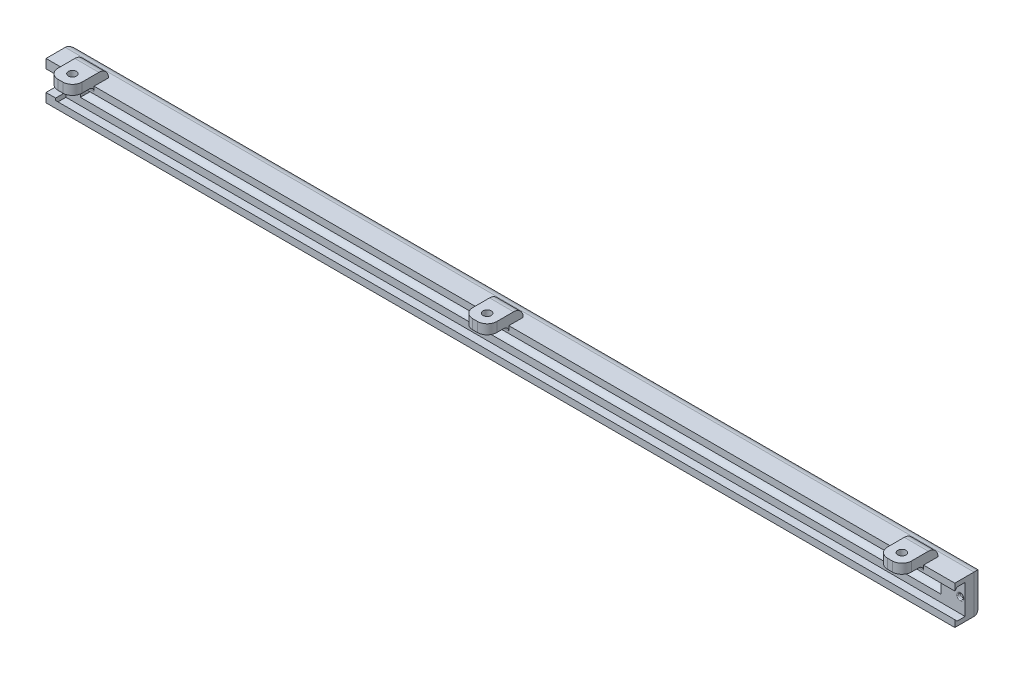
from build123d import *

# Parameters (mm, degrees)
SKETCH1_W               = 378
SKETCH1_H               = 16
BOSS_EXTRUDE1_DEPTH     = 6
CUT_EXTRUDE1_DEPTH      = 381.976768496
CUT_EXTRUDE1_DEPTH_BACK = 374
SKETCH3_W               = 4.3
SKETCH3_H               = 12.3
BOSS_EXTRUDE2_DEPTH     = 374
BOSS_EXTRUDE3_DEPTH     = 374
SKETCH6_W               = 4
SKETCH6_H               = 8.5
CUT_EXTRUDE2_DEPTH      = 378.00835287
SKETCH13_W              = 10
SKETCH13_H              = 15
BOSS_EXTRUDE5_DEPTH     = 4
FILLET10_R              = 4
SKETCH14_R              = 1.7
CUT_EXTRUDE5_DEPTH      = 4
FILLET11_R              = 4
FILLET12_R              = 4
LPATTERN3_COUNT         = 3
LPATTERN3_PITCH         = 172.5
LPATTERN4_COUNT         = 3
LPATTERN4_PITCH         = 172.5
FILLET13_R              = 4
FILLET14_R              = 4
FILLET16_R              = 4
FILLET17_R              = 4
FILLET18_R              = 4
FILLET19_R              = 4
FILLET20_R              = 2
FILLET21_R              = 2
FILLET22_R              = 2
SKETCH17_W              = 378
SKETCH17_H              = 16
BOSS_EXTRUDE6_DEPTH     = 6
FILLET25_R              = 4
SKETCH18_R              = 1
CUT_EXTRUDE6_DEPTH      = 0.7
FILLET26_R              = 0.5
FILLET27_R              = 0.5
SKETCH19_W              = 358
SKETCH19_H              = 6.3
CUT_EXTRUDE7_DEPTH      = 3
FILLET28_R              = 3


with BuildPart() as part:
    # Sketch1 → Boss-Extrude1 (new body)
    with BuildSketch(Plane.XY):
        with Locations((31.46991404, 39.151862464)):
            Rectangle(SKETCH1_W, SKETCH1_H)
    extrude(amount=BOSS_EXTRUDE1_DEPTH)

    # Sketch3 → Cut-Extrude1 (cut, two sides: drawn at the far end of the back side and taken through both)
    with BuildSketch(Plane(origin=(220.46991404, 0, 0), x_dir=(0, 0, -1), z_dir=(1, 0, 0)).offset(-CUT_EXTRUDE1_DEPTH_BACK)):
        with Locations((-3.85, 39.151862464)):
            Rectangle(SKETCH3_W, SKETCH3_H)
    extrude(amount=CUT_EXTRUDE1_DEPTH + CUT_EXTRUDE1_DEPTH_BACK, mode=Mode.SUBTRACT)

    # Sketch4 → Boss-Extrude2 (add)
    with BuildSketch(Plane(origin=(220.46991404, 0, 0), x_dir=(0, 0, -1), z_dir=(1, 0, 0))):
        Polygon((-6, 33.001862464), (-6, 34.001862464), (-5, 33.001862464), align=None)
    extrude(amount=-BOSS_EXTRUDE2_DEPTH)

    # Sketch5 → Boss-Extrude3 (add)
    with BuildSketch(Plane(origin=(220.46991404, 0, 0), x_dir=(0, 0, -1), z_dir=(1, 0, 0))):
        Polygon((-6, 45.301862464), (-6, 44.301862464), (-5, 45.301862464), align=None)
    extrude(amount=-BOSS_EXTRUDE3_DEPTH)

    # Sketch6 → Cut-Extrude2 (cut, through all)
    with BuildSketch(Plane(origin=(-153.53008596, 0, 0), x_dir=(0, 0, -1), z_dir=(1, 0, 0))):
        with Locations((-4, 39.151862464)):
            Rectangle(SKETCH6_W, SKETCH6_H)
    extrude(amount=-CUT_EXTRUDE2_DEPTH, mode=Mode.SUBTRACT)

    # Sketch13 → Boss-Extrude5 (add)
    with BuildSketch(Plane(origin=(0, 47.151862464, 0), x_dir=(1, 0, 0), z_dir=(0, 1, 0))):
        with Locations((-142.53008596, -7.5)):
            Rectangle(SKETCH13_W, SKETCH13_H)
    boss_extrude5 = extrude(amount=BOSS_EXTRUDE5_DEPTH)

    # Fillet10
    fillet10_edges = [part.edges().sort_by_distance(p)[0] for p in [
        (-142.53008596, 51.151862464, 0),
    ]]
    fillet(fillet10_edges, radius=FILLET10_R)

    # Sketch14 → Cut-Extrude5 (cut)
    with BuildSketch(Plane.XZ.offset(-47.151862464)):
        with Locations(Location((-142.53008596, 10, 0), (0, 0, 270))):
            Circle(SKETCH14_R)
    cut_extrude5 = extrude(amount=-CUT_EXTRUDE5_DEPTH, mode=Mode.SUBTRACT)

    # Fillet11
    fillet11_edges = [part.edges().sort_by_distance(p)[0] for p in [
        (-137.53008596, 49.151862464, 15),
    ]]
    fillet(fillet11_edges, radius=FILLET11_R)

    # Fillet12
    fillet12_edges = [part.edges().sort_by_distance(p)[0] for p in [
        (-147.53008596, 49.151862464, 15),
    ]]
    fillet(fillet12_edges, radius=FILLET12_R)

    # LPattern3: Boss-Extrude5 ×3
    with Locations(*[(i * LPATTERN3_PITCH, 0, 0) for i in range(1, LPATTERN3_COUNT)]):
        add(boss_extrude5)

    # LPattern4: Cut-Extrude5 ×3
    with Locations(*[(i * LPATTERN4_PITCH, 0, 0) for i in range(1, LPATTERN4_COUNT)]):
        add(cut_extrude5, mode=Mode.SUBTRACT)

    # Fillet13
    fillet13_edges = [part.edges().sort_by_distance(p)[0] for p in [
        (29.96991404, 51.151862464, 0),
    ]]
    fillet(fillet13_edges, radius=FILLET13_R)

    # Fillet14
    fillet14_edges = [part.edges().sort_by_distance(p)[0] for p in [
        (202.46991404, 51.151862464, 0),
    ]]
    fillet(fillet14_edges, radius=FILLET14_R)

    # Fillet16
    fillet16_edges = [part.edges().sort_by_distance(p)[0] for p in [
        (24.96991404, 49.151862464, 15),
    ]]
    fillet(fillet16_edges, radius=FILLET16_R)

    # Fillet17
    fillet17_edges = [part.edges().sort_by_distance(p)[0] for p in [
        (34.96991404, 49.151862464, 15),
    ]]
    fillet(fillet17_edges, radius=FILLET17_R)

    # Fillet18
    fillet18_edges = [part.edges().sort_by_distance(p)[0] for p in [
        (207.46991404, 49.151862464, 15),
    ]]
    fillet(fillet18_edges, radius=FILLET18_R)

    # Fillet19
    fillet19_edges = [part.edges().sort_by_distance(p)[0] for p in [
        (197.46991404, 49.151862464, 15),
    ]]
    fillet(fillet19_edges, radius=FILLET19_R)

    # Fillet20
    fillet20_edges = [part.edges().sort_by_distance(p)[0] for p in [
        (202.46991404, 47.151862464, 6),
    ]]
    fillet(fillet20_edges, radius=FILLET20_R)

    # Fillet21
    fillet21_edges = [part.edges().sort_by_distance(p)[0] for p in [
        (29.96991404, 47.151862464, 6),
    ]]
    fillet(fillet21_edges, radius=FILLET21_R)

    # Fillet22
    fillet22_edges = [part.edges().sort_by_distance(p)[0] for p in [
        (-142.53008596, 47.151862464, 6),
    ]]
    fillet(fillet22_edges, radius=FILLET22_R)

    # Sketch17 → Boss-Extrude6 (add)
    with BuildSketch(Plane(origin=(0, 0, 0), x_dir=(-1, 0, 0), z_dir=(0, 0, -1))):
        with Locations((-31.46991404, 39.151862464)):
            Rectangle(SKETCH17_W, SKETCH17_H)
    extrude(amount=BOSS_EXTRUDE6_DEPTH)

    # Fillet25
    fillet25_edges = [part.edges().sort_by_distance(p)[0] for p in [
        (220.46991404, 39.151862464, -6),
        (31.46991404, 31.151862464, -6),
        (-157.53008596, 39.151862464, -6),
        (31.46991404, 47.151862464, -6),
    ]]
    fillet(fillet25_edges, radius=FILLET25_R)

    # Sketch18 → Cut-Extrude6 (cut)
    with BuildSketch(Plane.XY.offset(1.7)):
        with Locations((218.46991404, 39.151862464)):
            Circle(SKETCH18_R)
    extrude(amount=-CUT_EXTRUDE6_DEPTH, mode=Mode.SUBTRACT)

    # Fillet26
    fillet26_edges = [part.edges().sort_by_distance(p)[0] for p in [
        (217.46991404, 39.151862464, 1.7),
    ]]
    fillet(fillet26_edges, radius=FILLET26_R)

    # Fillet27
    fillet27_edges = [part.edges().sort_by_distance(p)[0] for p in [
        (217.46991404, 39.151862464, 1),
    ]]
    fillet(fillet27_edges, radius=FILLET27_R)

    # Sketch19 → Cut-Extrude7 (cut)
    with BuildSketch(Plane.XY.offset(1.7)):
        with Locations((31.46991404, 39.151862464)):
            Rectangle(SKETCH19_W, SKETCH19_H)
    extrude(amount=-CUT_EXTRUDE7_DEPTH, mode=Mode.SUBTRACT)

    # Fillet28
    fillet28_edges = [part.edges().sort_by_distance(p)[0] for p in [
        (31.46991404, 42.301862464, -1.3),
        (210.46991404, 39.151862464, -1.3),
        (31.46991404, 36.001862464, -1.3),
        (-147.53008596, 39.151862464, -1.3),
    ]]
    fillet(fillet28_edges, radius=FILLET28_R - 0.0001)  # a hair under: the kernel refuses the full size


solid = part.part
